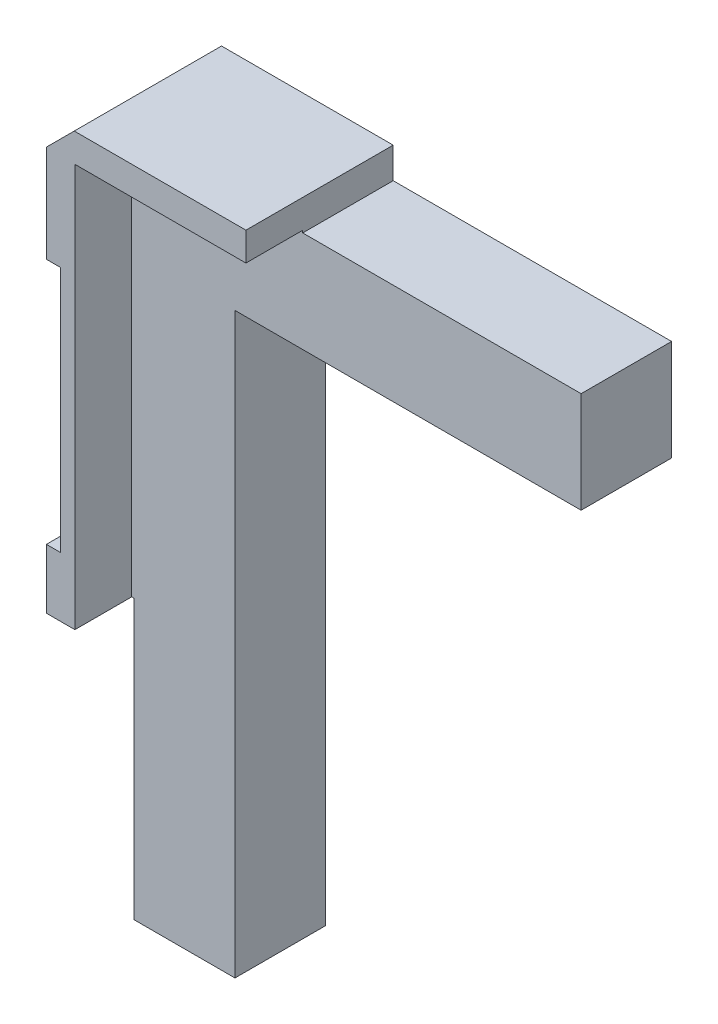
from build123d import *

# Parameters (mm, degrees)
BODY_AND_TONGUES_DEPTH = 4.875
RIM_DEPTH              = 7.935
BRACKET_SEAT_SKETCH_W  = 2.5
BRACKET_SEAT_SKETCH_H  = 26.6
BRACKET_SEAT_DEPTH     = 8.935
SCREW_PILOTS_SKETCH_R  = 1.35
SCREW_PILOTS_DEPTH     = 5.5


with BuildPart() as part:
    # body and tongues sketch → body and tongues (new, symmetric)
    with BuildSketch(Plane.XY.offset(20.375)):
        Polygon((-3.42, 3.07), (-0.42, 6.07), (18.08, 6.07), (18.08, 2.75), (48.08, 2.75), (48.08, -8.13), (10.78, -8.13), (10.78, -70.43), (-0.1, -70.43), (-0.1, -40.43), (-3.42, -40.43), align=None)
    extrude(amount=BODY_AND_TONGUES_DEPTH, both=True)

    # rim sketch → rim (add, symmetric)
    with BuildSketch(Plane.XY.offset(23.435)):
        Polygon((-3.42, 3.07), (-0.42, 6.07), (18.08, 6.07), (18.08, 3), (-0.35, 3), (-0.35, -40.43), (-3.42, -40.43), align=None)
    extrude(amount=RIM_DEPTH, both=True)

    # bracket seat sketch → bracket seat (cut, symmetric)
    with BuildSketch(Plane.XY.offset(23.435)):
        with Locations((-3.17, -20.7)):
            Rectangle(BRACKET_SEAT_SKETCH_W, BRACKET_SEAT_SKETCH_H)
    extrude(amount=BRACKET_SEAT_DEPTH, both=True, mode=Mode.SUBTRACT)

    # screw pilots sketch → screw pilots (cut, symmetric)
    with BuildSketch(Plane(origin=(2.58, 0, 0), x_dir=(0, 0, -1), z_dir=(1, 0, 0))):
        with Locations((-20.375, -28.7)):
            Circle(SCREW_PILOTS_SKETCH_R)
        with Locations((-20.375, -12.7)):
            Circle(SCREW_PILOTS_SKETCH_R)
    extrude(amount=SCREW_PILOTS_DEPTH, both=True, mode=Mode.SUBTRACT)


solid = part.part
